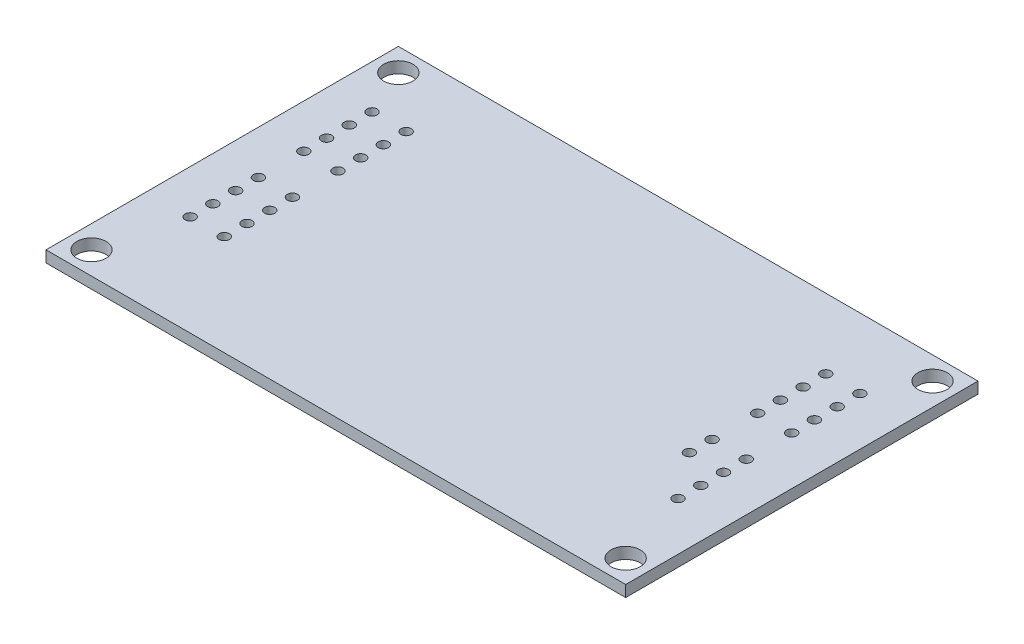
from build123d import *

# Parameters (mm, degrees)
SKETCH1_W                  = 64.77
SKETCH1_H                  = 39.37
BOSS_EXTRUDE1_DEPTH        = 1.27
F_4_CLEARANCE_HOLE1_D      = 3.2639
F_4_CLEARANCE_HOLE1_DEPTH  = 7.5946
F_4_CLEARANCE_HOLE1_TIP    = 0.980574487
SKETCH4_R                  = 0.5715
CUT_EXTRUDE1_DEPTH         = 38.919656512
LPATTERN1_COUNT            = 4
LPATTERN1_PITCH            = 2.54
LPATTERN2_COPY_1_SKETCH_R  = 0.5715
LPATTERN2_COPY_1_DEPTH     = 38.919656512
LPATTERN2_COPY_2_SKETCH_R  = 0.5715
LPATTERN2_COPY_2_DEPTH     = 38.919656512
LPATTERN2_COPY_3_SKETCH_R  = 0.5715
LPATTERN2_COPY_3_DEPTH     = 38.919656512
LPATTERN2_COPY_4_SKETCH_R  = 0.5715
LPATTERN2_COPY_4_DEPTH     = 38.919656512
LPATTERN2_COPY_5_SKETCH_R  = 0.5715
LPATTERN2_COPY_5_DEPTH     = 38.919656512
LPATTERN2_COPY_6_SKETCH_R  = 0.5715
LPATTERN2_COPY_6_DEPTH     = 38.919656512
LPATTERN2_COPY_7_SKETCH_R  = 0.5715
LPATTERN2_COPY_7_DEPTH     = 38.919656512
LPATTERN2_COPY_8_SKETCH_R  = 0.5715
LPATTERN2_COPY_8_DEPTH     = 38.919656512
LPATTERN2_COPY_9_SKETCH_R  = 0.5715
LPATTERN2_COPY_9_DEPTH     = 38.919656512
LPATTERN2_COPY_10_SKETCH_R = 0.5715
LPATTERN2_COPY_10_DEPTH    = 38.919656512
LPATTERN2_COPY_11_SKETCH_R = 0.5715
LPATTERN2_COPY_11_DEPTH    = 38.919656512
LPATTERN2_COPY_12_SKETCH_R = 0.5715
LPATTERN2_COPY_12_DEPTH    = 38.919656512
SKETCH5_R                  = 0.5715
CUT_EXTRUDE2_DEPTH         = 38.919656512
LPATTERN3_COUNT            = 4
LPATTERN3_PITCH            = 2.54
LPATTERN4_COPY_1_SKETCH_R  = 0.5715
LPATTERN4_COPY_1_DEPTH     = 38.919656512
LPATTERN4_COPY_2_SKETCH_R  = 0.5715
LPATTERN4_COPY_2_DEPTH     = 38.919656512
LPATTERN4_COPY_3_SKETCH_R  = 0.5715
LPATTERN4_COPY_3_DEPTH     = 38.919656512
LPATTERN4_COPY_4_SKETCH_R  = 0.5715
LPATTERN4_COPY_4_DEPTH     = 38.919656512
LPATTERN4_COPY_5_SKETCH_R  = 0.5715
LPATTERN4_COPY_5_DEPTH     = 38.919656512
LPATTERN4_COPY_6_SKETCH_R  = 0.5715
LPATTERN4_COPY_6_DEPTH     = 38.919656512
LPATTERN4_COPY_7_SKETCH_R  = 0.5715
LPATTERN4_COPY_7_DEPTH     = 38.919656512
LPATTERN4_COPY_8_SKETCH_R  = 0.5715
LPATTERN4_COPY_8_DEPTH     = 38.919656512
SKETCH6_R                  = 0.5715
CUT_EXTRUDE3_DEPTH         = 38.919656512


with BuildPart() as part:
    # Sketch1 → Boss-Extrude1 (new body)
    with BuildSketch(Plane(origin=(0, 0, 0), x_dir=(1, 0, 0), z_dir=(0, 1, 0))):
        Rectangle(SKETCH1_W, SKETCH1_H)
    extrude(amount=BOSS_EXTRUDE1_DEPTH)

    # #4 Clearance Hole1
    with Locations(Plane(origin=(0, 1.27, 0), x_dir=(1, 0, 0), z_dir=(0, 1, 0))):
        with Locations((-29.845, 17.145), (-29.845, -17.145), (29.845, -17.145), (29.845, 17.145)):
            Hole(F_4_CLEARANCE_HOLE1_D / 2, depth=F_4_CLEARANCE_HOLE1_DEPTH)
            with Locations((0, 0, -(F_4_CLEARANCE_HOLE1_DEPTH + F_4_CLEARANCE_HOLE1_TIP / 2))):  # 118° drill point
                Cone(0, F_4_CLEARANCE_HOLE1_D / 2, F_4_CLEARANCE_HOLE1_TIP, mode=Mode.SUBTRACT)

    # Sketch4 → Cut-Extrude1 (cut, through all)
    with BuildSketch(Plane(origin=(0, 1.27, 0), x_dir=(1, 0, 0), z_dir=(0, 1, 0))):
        with Locations((-27.516760394, 11.875691834)):
            Circle(SKETCH4_R)
    cut_extrude1 = extrude(amount=-CUT_EXTRUDE1_DEPTH, mode=Mode.SUBTRACT)

    # LPattern1: Cut-Extrude1 ×4
    with Locations(*[(0, 0, i * LPATTERN1_PITCH) for i in range(1, LPATTERN1_COUNT)]):
        add(cut_extrude1, mode=Mode.SUBTRACT)

    # LPattern2 copy 1 sketch → LPattern2 copy 1 (cut, through all)
    with BuildSketch(Plane(origin=(0, 1.27, 15.24), x_dir=(1, 0, 0), z_dir=(0, 1, 0))):
        with Locations((-27.516760394, 11.875691834)):
            Circle(LPATTERN2_COPY_1_SKETCH_R)
    extrude(amount=-LPATTERN2_COPY_1_DEPTH, mode=Mode.SUBTRACT)

    # LPattern2 copy 2 sketch → LPattern2 copy 2 (cut, through all)
    with BuildSketch(Plane(origin=(3.81, 1.27, 2.54), x_dir=(1, 0, 0), z_dir=(0, 1, 0))):
        with Locations((-27.516760394, 11.875691834)):
            Circle(LPATTERN2_COPY_2_SKETCH_R)
    extrude(amount=-LPATTERN2_COPY_2_DEPTH, mode=Mode.SUBTRACT)

    # LPattern2 copy 3 sketch → LPattern2 copy 3 (cut, through all)
    with BuildSketch(Plane(origin=(3.81, 1.27, 15.24), x_dir=(1, 0, 0), z_dir=(0, 1, 0))):
        with Locations((-27.516760394, 11.875691834)):
            Circle(LPATTERN2_COPY_3_SKETCH_R)
    extrude(amount=-LPATTERN2_COPY_3_DEPTH, mode=Mode.SUBTRACT)

    # LPattern2 copy 4 sketch → LPattern2 copy 4 (cut, through all)
    with BuildSketch(Plane(origin=(0, 1.27, 17.78), x_dir=(1, 0, 0), z_dir=(0, 1, 0))):
        with Locations((-27.516760394, 11.875691834)):
            Circle(LPATTERN2_COPY_4_SKETCH_R)
    extrude(amount=-LPATTERN2_COPY_4_DEPTH, mode=Mode.SUBTRACT)

    # LPattern2 copy 5 sketch → LPattern2 copy 5 (cut, through all)
    with BuildSketch(Plane(origin=(3.81, 1.27, 5.08), x_dir=(1, 0, 0), z_dir=(0, 1, 0))):
        with Locations((-27.516760394, 11.875691834)):
            Circle(LPATTERN2_COPY_5_SKETCH_R)
    extrude(amount=-LPATTERN2_COPY_5_DEPTH, mode=Mode.SUBTRACT)

    # LPattern2 copy 6 sketch → LPattern2 copy 6 (cut, through all)
    with BuildSketch(Plane(origin=(3.81, 1.27, 17.78), x_dir=(1, 0, 0), z_dir=(0, 1, 0))):
        with Locations((-27.516760394, 11.875691834)):
            Circle(LPATTERN2_COPY_6_SKETCH_R)
    extrude(amount=-LPATTERN2_COPY_6_DEPTH, mode=Mode.SUBTRACT)

    # LPattern2 copy 7 sketch → LPattern2 copy 7 (cut, through all)
    with BuildSketch(Plane(origin=(0, 1.27, 20.32), x_dir=(1, 0, 0), z_dir=(0, 1, 0))):
        with Locations((-27.516760394, 11.875691834)):
            Circle(LPATTERN2_COPY_7_SKETCH_R)
    extrude(amount=-LPATTERN2_COPY_7_DEPTH, mode=Mode.SUBTRACT)

    # LPattern2 copy 8 sketch → LPattern2 copy 8 (cut, through all)
    with BuildSketch(Plane(origin=(3.81, 1.27, 7.62), x_dir=(1, 0, 0), z_dir=(0, 1, 0))):
        with Locations((-27.516760394, 11.875691834)):
            Circle(LPATTERN2_COPY_8_SKETCH_R)
    extrude(amount=-LPATTERN2_COPY_8_DEPTH, mode=Mode.SUBTRACT)

    # LPattern2 copy 9 sketch → LPattern2 copy 9 (cut, through all)
    with BuildSketch(Plane(origin=(3.81, 1.27, 20.32), x_dir=(1, 0, 0), z_dir=(0, 1, 0))):
        with Locations((-27.516760394, 11.875691834)):
            Circle(LPATTERN2_COPY_9_SKETCH_R)
    extrude(amount=-LPATTERN2_COPY_9_DEPTH, mode=Mode.SUBTRACT)

    # LPattern2 copy 10 sketch → LPattern2 copy 10 (cut, through all)
    with BuildSketch(Plane(origin=(0, 1.27, 12.7), x_dir=(1, 0, 0), z_dir=(0, 1, 0))):
        with Locations((-27.516760394, 11.875691834)):
            Circle(LPATTERN2_COPY_10_SKETCH_R)
    extrude(amount=-LPATTERN2_COPY_10_DEPTH, mode=Mode.SUBTRACT)

    # LPattern2 copy 11 sketch → LPattern2 copy 11 (cut, through all)
    with BuildSketch(Plane(origin=(3.81, 1.27, 0), x_dir=(1, 0, 0), z_dir=(0, 1, 0))):
        with Locations((-27.516760394, 11.875691834)):
            Circle(LPATTERN2_COPY_11_SKETCH_R)
    extrude(amount=-LPATTERN2_COPY_11_DEPTH, mode=Mode.SUBTRACT)

    # LPattern2 copy 12 sketch → LPattern2 copy 12 (cut, through all)
    with BuildSketch(Plane(origin=(3.81, 1.27, 12.7), x_dir=(1, 0, 0), z_dir=(0, 1, 0))):
        with Locations((-27.516760394, 11.875691834)):
            Circle(LPATTERN2_COPY_12_SKETCH_R)
    extrude(amount=-LPATTERN2_COPY_12_DEPTH, mode=Mode.SUBTRACT)

    # Sketch5 → Cut-Extrude2 (cut, through all)
    with BuildSketch(Plane(origin=(0, 1.27, 0), x_dir=(1, 0, 0), z_dir=(0, 1, 0))):
        with Locations((26.997015049, 11.875691834)):
            Circle(SKETCH5_R)
    cut_extrude2 = extrude(amount=-CUT_EXTRUDE2_DEPTH, mode=Mode.SUBTRACT)

    # LPattern3: Cut-Extrude2 ×4
    with Locations(*[(0, 0, i * LPATTERN3_PITCH) for i in range(1, LPATTERN3_COUNT)]):
        add(cut_extrude2, mode=Mode.SUBTRACT)

    # LPattern4 copy 1 sketch → LPattern4 copy 1 (cut, through all)
    with BuildSketch(Plane(origin=(-3.81, 1.27, 2.54), x_dir=(1, 0, 0), z_dir=(0, 1, 0))):
        with Locations((26.997015049, 11.875691834)):
            Circle(LPATTERN4_COPY_1_SKETCH_R)
    extrude(amount=-LPATTERN4_COPY_1_DEPTH, mode=Mode.SUBTRACT)

    # LPattern4 copy 2 sketch → LPattern4 copy 2 (cut, through all)
    with BuildSketch(Plane(origin=(0, 1.27, 15.24), x_dir=(1, 0, 0), z_dir=(0, 1, 0))):
        with Locations((26.997015049, 11.875691834)):
            Circle(LPATTERN4_COPY_2_SKETCH_R)
    extrude(amount=-LPATTERN4_COPY_2_DEPTH, mode=Mode.SUBTRACT)

    # LPattern4 copy 3 sketch → LPattern4 copy 3 (cut, through all)
    with BuildSketch(Plane(origin=(-3.81, 1.27, 5.08), x_dir=(1, 0, 0), z_dir=(0, 1, 0))):
        with Locations((26.997015049, 11.875691834)):
            Circle(LPATTERN4_COPY_3_SKETCH_R)
    extrude(amount=-LPATTERN4_COPY_3_DEPTH, mode=Mode.SUBTRACT)

    # LPattern4 copy 4 sketch → LPattern4 copy 4 (cut, through all)
    with BuildSketch(Plane(origin=(0, 1.27, 17.78), x_dir=(1, 0, 0), z_dir=(0, 1, 0))):
        with Locations((26.997015049, 11.875691834)):
            Circle(LPATTERN4_COPY_4_SKETCH_R)
    extrude(amount=-LPATTERN4_COPY_4_DEPTH, mode=Mode.SUBTRACT)

    # LPattern4 copy 5 sketch → LPattern4 copy 5 (cut, through all)
    with BuildSketch(Plane(origin=(-3.81, 1.27, 7.62), x_dir=(1, 0, 0), z_dir=(0, 1, 0))):
        with Locations((26.997015049, 11.875691834)):
            Circle(LPATTERN4_COPY_5_SKETCH_R)
    extrude(amount=-LPATTERN4_COPY_5_DEPTH, mode=Mode.SUBTRACT)

    # LPattern4 copy 6 sketch → LPattern4 copy 6 (cut, through all)
    with BuildSketch(Plane(origin=(0, 1.27, 20.32), x_dir=(1, 0, 0), z_dir=(0, 1, 0))):
        with Locations((26.997015049, 11.875691834)):
            Circle(LPATTERN4_COPY_6_SKETCH_R)
    extrude(amount=-LPATTERN4_COPY_6_DEPTH, mode=Mode.SUBTRACT)

    # LPattern4 copy 7 sketch → LPattern4 copy 7 (cut, through all)
    with BuildSketch(Plane(origin=(-3.81, 1.27, 0), x_dir=(1, 0, 0), z_dir=(0, 1, 0))):
        with Locations((26.997015049, 11.875691834)):
            Circle(LPATTERN4_COPY_7_SKETCH_R)
    extrude(amount=-LPATTERN4_COPY_7_DEPTH, mode=Mode.SUBTRACT)

    # LPattern4 copy 8 sketch → LPattern4 copy 8 (cut, through all)
    with BuildSketch(Plane(origin=(0, 1.27, 12.7), x_dir=(1, 0, 0), z_dir=(0, 1, 0))):
        with Locations((26.997015049, 11.875691834)):
            Circle(LPATTERN4_COPY_8_SKETCH_R)
    extrude(amount=-LPATTERN4_COPY_8_DEPTH, mode=Mode.SUBTRACT)

    # Sketch6 → Cut-Extrude3 (cut, through all)
    with BuildSketch(Plane(origin=(0, 1.27, 0), x_dir=(1, 0, 0), z_dir=(0, 1, 0))):
        with Locations((23.187015049, -0.824308166)):
            Circle(SKETCH6_R)
        with Locations((23.187015049, -3.364308166)):
            Circle(SKETCH6_R)
    extrude(amount=-CUT_EXTRUDE3_DEPTH, mode=Mode.SUBTRACT)


solid = part.part
